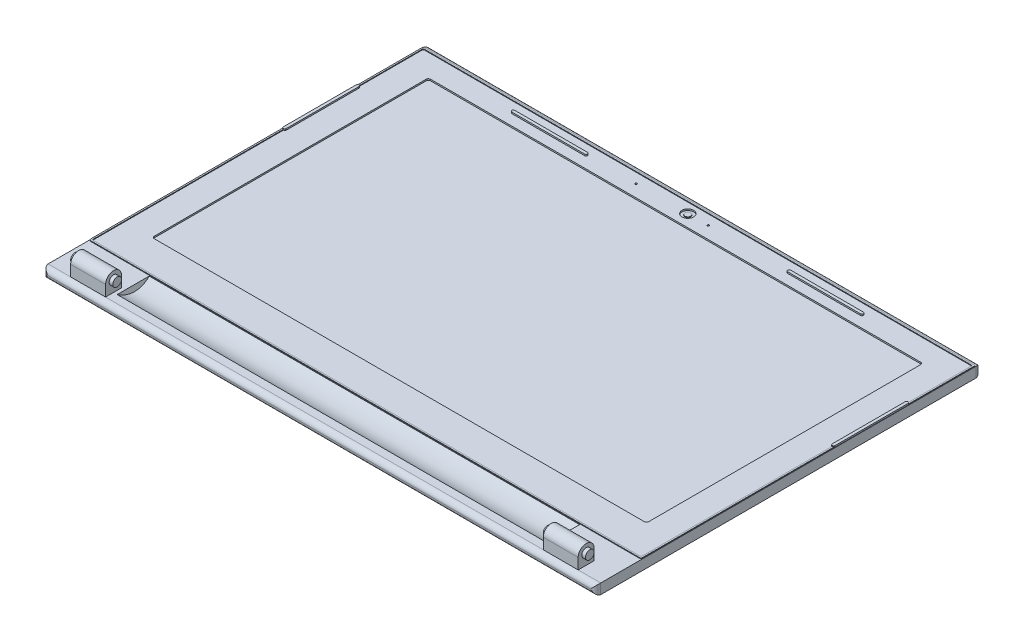
from build123d import *

# Parameters (mm, degrees)
SKETCH1_W            = 380
SKETCH1_H            = 265
BOSS_EXTRUDE1_DEPTH  = 7
FILLET2_R            = 3.5
BOSS_EXTRUDE2_DEPTH  = 0.5
CUT_EXTRUDE1_DEPTH   = 1
SKETCH4_R            = 4
CUT_EXTRUDE2_DEPTH   = 1
SKETCH5_R            = 0.625
CUT_EXTRUDE3_DEPTH   = 1
SKETCH6_R            = 0.625
CUT_EXTRUDE4_DEPTH   = 1
SKETCH7_W            = 24
SKETCH7_H            = 10.979763194
BOSS_EXTRUDE3_DEPTH  = 13
CUT_EXTRUDE6_DEPTH   = 27
SKETCH9_R            = 3
BOSS_EXTRUDE4_DEPTH  = 2.5
BOSS_EXTRUDE5_START  = 2.5
SKETCH10_R           = 3
BOSS_EXTRUDE5_DEPTH  = 2.5
SKETCH11_W           = 24
SKETCH11_H           = 10.98
BOSS_EXTRUDE6_DEPTH  = 13
CUT_EXTRUDE9_DEPTH   = 296
SKETCH22_R           = 3
BOSS_EXTRUDE7_DEPTH  = 2.5
BOSS_EXTRUDE8_START  = 2.5
SKETCH23_R           = 3
BOSS_EXTRUDE8_DEPTH  = 2.5
CUT_EXTRUDE10_DEPTH  = 296
DRAFT1_ANGLE         = 20
DRAFT2_ANGLE         = 20
BOSS_EXTRUDE9_DEPTH  = 1
SKETCH33_R           = 2
BOSS_EXTRUDE10_DEPTH = 0.5


with BuildPart() as part:
    # Sketch1 → Boss-Extrude1 (new body)
    with BuildSketch(Plane(origin=(0, 0, 0), x_dir=(1, 0, 0), z_dir=(0, 1, 0))):
        with Locations((190, -132.5)):
            Rectangle(SKETCH1_W, SKETCH1_H)
    extrude(amount=BOSS_EXTRUDE1_DEPTH)

    # Fillet2
    fillet2_edges = [part.edges().sort_by_distance(p)[0] for p in [
        (190, 7, 0),
        (190, 0, 0),
        (190, 0, 265),
        (190, 7, 265),
        (0, 3.5, 0),
        (380, 3.5, 0),
        (380, 3.5, 265),
        (0, 3.5, 265),
    ]]
    fillet(fillet2_edges, radius=FILLET2_R - 0.0001)  # a hair under: the kernel refuses the full size

    # Sketch2 → Boss-Extrude2 (add)
    with BuildSketch(Plane(origin=(0, 7, 0), x_dir=(1, 0, 0), z_dir=(0, 1, 0))):
        with BuildLine():
            Line((1.25, -3.75), (378.75, -3.75))
            ThreePointArc((378.75, -3.75), (379.457106781, -4.042893219), (379.75, -4.75))
            Line((379.75, -4.75), (379.75, -232.5))
            ThreePointArc((379.75, -232.5), (379.457106781, -233.207106781), (378.75, -233.5))
            Line((378.75, -233.5), (1.25, -233.5))
            ThreePointArc((1.25, -233.5), (0.542893219, -233.207106781), (0.25, -232.5))
            Line((0.25, -232.5), (0.25, -4.75))
            ThreePointArc((0.25, -4.75), (0.542893219, -4.042893219), (1.25, -3.75))
        make_face()
        with BuildLine():
            Line((2.25, -4.75), (377.75, -4.75))
            ThreePointArc((377.75, -4.75), (378.457106781, -5.042893219), (378.75, -5.75))
            Line((378.75, -5.75), (378.75, -231.5))
            ThreePointArc((378.75, -231.5), (378.457106781, -232.207106781), (377.75, -232.5))
            Line((377.75, -232.5), (2.25, -232.5))
            ThreePointArc((2.25, -232.5), (1.542893219, -232.207106781), (1.25, -231.5))
            Line((1.25, -231.5), (1.25, -5.75))
            ThreePointArc((1.25, -5.75), (1.542893219, -5.042893219), (2.25, -4.75))
        make_face(mode=Mode.SUBTRACT)
    extrude(amount=BOSS_EXTRUDE2_DEPTH)

    # Sketch3 → Cut-Extrude1 (cut)
    with BuildSketch(Plane(origin=(0, 7, 0), x_dir=(1, 0, 0), z_dir=(0, 1, 0))):
        with BuildLine():
            Line((21.5, -20), (358.5, -20))
            ThreePointArc((358.5, -20), (359.560660172, -20.439339828), (360, -21.5))
            Line((360, -21.5), (360, -208.5))
            ThreePointArc((360, -208.5), (359.560660172, -209.560660172), (358.5, -210))
            Line((358.5, -210), (21.5, -210))
            ThreePointArc((21.5, -210), (20.439339828, -209.560660172), (20, -208.5))
            Line((20, -208.5), (20, -21.5))
            ThreePointArc((20, -21.5), (20.439339828, -20.439339828), (21.5, -20))
        make_face()
    extrude(amount=-CUT_EXTRUDE1_DEPTH, mode=Mode.SUBTRACT)

    # Sketch4 → Cut-Extrude2 (cut)
    with BuildSketch(Plane(origin=(0, 7, 0), x_dir=(1, 0, 0), z_dir=(0, 1, 0))):
        with Locations(Location((190, -11.584908102, 0), (0, 0, 270))):
            Circle(SKETCH4_R)
    extrude(amount=-CUT_EXTRUDE2_DEPTH, mode=Mode.SUBTRACT)

    # Sketch5 → Cut-Extrude3 (cut)
    with BuildSketch(Plane(origin=(0, 7, 0), x_dir=(1, 0, 0), z_dir=(0, 1, 0))):
        with Locations(Location((154.376617555, -11.584908102, 0), (0, 0, 270))):
            Circle(SKETCH5_R)
    extrude(amount=-CUT_EXTRUDE3_DEPTH, mode=Mode.SUBTRACT)

    # Sketch6 → Cut-Extrude4 (cut)
    with BuildSketch(Plane(origin=(0, 7, 0), x_dir=(1, 0, 0), z_dir=(0, 1, 0))):
        with Locations(Location((204.109733731, -11.584908102, 0), (0, 0, 270))):
            Circle(SKETCH6_R)
    extrude(amount=-CUT_EXTRUDE4_DEPTH, mode=Mode.SUBTRACT)

    # Sketch7 → Boss-Extrude3 (add)
    with BuildSketch(Plane(origin=(0, 7, 0), x_dir=(1, 0, 0), z_dir=(0, 1, 0))):
        with Locations((27.5, -256.010118403)):
            Rectangle(SKETCH7_W, SKETCH7_H)
    extrude(amount=BOSS_EXTRUDE3_DEPTH)

    # Sketch8 → Cut-Extrude6 (cut)
    with BuildSketch(Plane.ZY.offset(-15.5)):
        with BuildLine():
            Line((250.520236806, 20), (250.520236806, 14.510118403))
            ThreePointArc((250.520236806, 14.510118403), (252.128185898, 18.392050908), (256.010118403, 20))
            Line((256.010118403, 20), (250.520236806, 20))
        make_face()
        with BuildLine():
            Line((261.5, 20), (256.010118403, 20))
            ThreePointArc((256.010118403, 20), (259.892050908, 18.392050908), (261.5, 14.510118403))
            Line((261.5, 14.510118403), (261.5, 20))
        make_face()
    extrude(amount=-CUT_EXTRUDE6_DEPTH, mode=Mode.SUBTRACT)

    # Sketch9 → Boss-Extrude4 (add)
    with BuildSketch(Plane.ZY.offset(-15.5)):
        with Locations(Location((256.010118403, 14.510118403, 0), (0, 0, 180))):
            Circle(SKETCH9_R)
    extrude(amount=BOSS_EXTRUDE4_DEPTH)

    # Sketch10 → Boss-Extrude5 (add)
    with BuildSketch(Plane(origin=(39.5, 0, 0), x_dir=(0, 0, -1), z_dir=(1, 0, 0)).offset(BOSS_EXTRUDE5_START)):
        with Locations((-256.010118403, 14.510118403)):
            Circle(SKETCH10_R)
    extrude(amount=-BOSS_EXTRUDE5_DEPTH)

    # Sketch11 → Boss-Extrude6 (add)
    with BuildSketch(Plane(origin=(0, 7, 0), x_dir=(1, 0, 0), z_dir=(0, 1, 0))):
        with Locations((352.5, -256.01)):
            Rectangle(SKETCH11_W, SKETCH11_H)
    extrude(amount=BOSS_EXTRUDE6_DEPTH)

    # Sketch21 → Cut-Extrude9 (cut)
    with BuildSketch(Plane(origin=(364.5, 0, 0), x_dir=(0, 0, -1), z_dir=(1, 0, 0))):
        with BuildLine():
            Line((-250.52, 20), (-256.01, 20))
            ThreePointArc((-256.01, 20), (-252.127983771, 18.392016229), (-250.52, 14.51))
            Line((-250.52, 14.51), (-250.52, 20))
        make_face()
        with BuildLine():
            Line((-261.5, 20), (-261.5, 14.51))
            ThreePointArc((-261.5, 14.51), (-259.892016229, 18.392016229), (-256.01, 20))
            Line((-256.01, 20), (-261.5, 20))
        make_face()
    extrude(amount=-CUT_EXTRUDE9_DEPTH, mode=Mode.SUBTRACT)

    # Sketch22 → Boss-Extrude7 (add)
    with BuildSketch(Plane(origin=(364.5, 0, 0), x_dir=(0, 0, -1), z_dir=(1, 0, 0))):
        with Locations(Location((-256.01, 14.51, 0), (0, 0, 180))):
            Circle(SKETCH22_R)
    extrude(amount=BOSS_EXTRUDE7_DEPTH)

    # Sketch23 → Boss-Extrude8 (add)
    with BuildSketch(Plane.ZY.offset(-340.5).offset(BOSS_EXTRUDE8_START)):
        with Locations((256.01, 14.51)):
            Circle(SKETCH23_R)
    extrude(amount=-BOSS_EXTRUDE8_DEPTH)

    # Sketch31 → Cut-Extrude10 (cut)
    with BuildSketch(Plane(origin=(42, 0, 0), x_dir=(0, 0, -1), z_dir=(1, 0, 0))):
        with BuildLine():
            Line((-256.010118403, 7), (-234.010118403, 7))
            ThreePointArc((-234.010118403, 7), (-245.010118403, 3.88854382), (-256.010118403, 7))
        make_face()
    extrude(amount=CUT_EXTRUDE10_DEPTH, mode=Mode.SUBTRACT)

    # Draft1
    draft1_faces = [part.faces().sort_by_distance(p)[0] for p in [
        (338, 5.747159877, 245.010118403),
    ]]
    draft(draft1_faces, Plane.ZX.offset(7), DRAFT1_ANGLE)

    # Draft2
    draft2_faces = [part.faces().sort_by_distance(p)[0] for p in [
        (42, 5.747159877, 245.010118403),
    ]]
    draft(draft2_faces, Plane.ZX.offset(7), DRAFT2_ANGLE)

    # Sketch32 → Boss-Extrude9 (add)
    with BuildSketch(Plane(origin=(0, 7, 0), x_dir=(1, 0, 0), z_dir=(0, 1, 0))):
        with BuildLine():
            Line((70, -10.584908102), (120, -10.584908102))
            ThreePointArc((120, -10.584908102), (121, -11.584908102), (120, -12.584908102))
            Line((120, -12.584908102), (70, -12.584908102))
            ThreePointArc((70, -12.584908102), (69, -11.584908102), (70, -10.584908102))
        make_face()
        with BuildLine():
            Line((260, -10.881099807), (310, -10.881099807))
            ThreePointArc((310, -10.881099807), (311, -11.881099807), (310, -12.881099807))
            Line((310, -12.881099807), (260, -12.881099807))
            ThreePointArc((260, -12.881099807), (259, -11.881099807), (260, -10.881099807))
        make_face()
        with BuildLine():
            Line((2.25, -50), (2.25, -100))
            ThreePointArc((2.25, -100), (1.25, -101), (0.25, -100))
            Line((0.25, -100), (0.25, -50))
            ThreePointArc((0.25, -50), (1.25, -49), (2.25, -50))
        make_face()
        with BuildLine():
            Line((379.75, -50), (379.75, -100))
            ThreePointArc((379.75, -100), (378.75, -101), (377.75, -100))
            Line((377.75, -100), (377.75, -50))
            ThreePointArc((377.75, -50), (378.75, -49), (379.75, -50))
        make_face()
    extrude(amount=BOSS_EXTRUDE9_DEPTH)

    # Sketch33 → Boss-Extrude10 (add)
    with BuildSketch(Plane(origin=(0, 6, 0), x_dir=(1, 0, 0), z_dir=(0, 1, 0))):
        with Locations(Location((190, -11.584908102, 0), (0, 0, 270))):
            Circle(SKETCH33_R)
    extrude(amount=BOSS_EXTRUDE10_DEPTH)


solid = part.part
